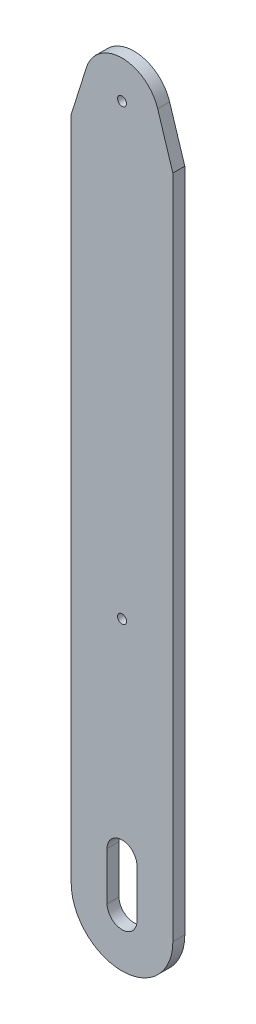
from build123d import *

# Parameters (mm, degrees)
ESQUISSE1_R               = 1.5
T_LE_DE_BASE_PLI_E1_DEPTH = 4


# Sheet-metal steps are written as plain solids
with BuildPart() as part:
    # Esquisse1 → Tôle de base pliée1 (new body)
    with BuildSketch(Plane.XY):
        with BuildLine():
            Line((-17, -12.348242597), (-17, -235))
            ThreePointArc((-17, -235), (0, -252), (17, -235))
            Line((17, -235), (17, -12.348242597))
            Line((17, -12.348242597), (11.921461884, 3.758822494))
            ThreePointArc((11.921461884, 3.758822494), (0, 12.5), (-11.921461884, 3.758822494))
            Line((-11.921461884, 3.758822494), (-17, -12.348242597))
        make_face()
        Circle(ESQUISSE1_R, mode=Mode.SUBTRACT)
        with Locations((0, -150)):
            Circle(ESQUISSE1_R, mode=Mode.SUBTRACT)
        with BuildLine():
            Line((-5, -235), (-5, -219))
            ThreePointArc((-5, -219), (0, -214), (5, -219))
            Line((5, -219), (5, -235))
            ThreePointArc((5, -235), (0, -240), (-5, -235))
        make_face(mode=Mode.SUBTRACT)
    extrude(amount=-T_LE_DE_BASE_PLI_E1_DEPTH)


solid = part.part
